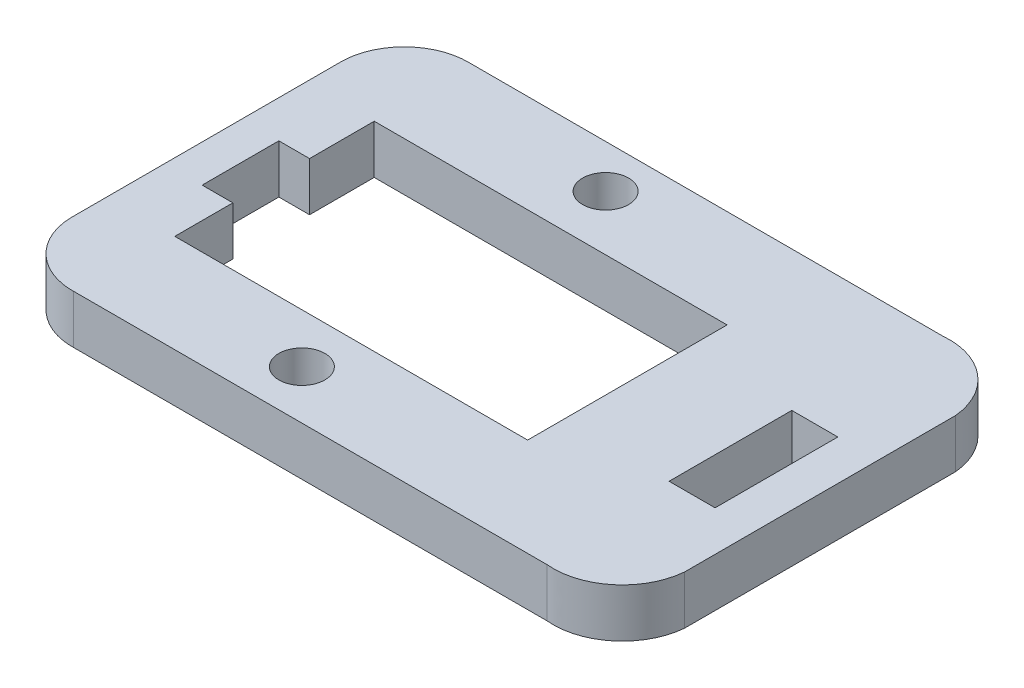
from build123d import *

# Parameters (mm, degrees)
SKETCH1_R           = 1.499950003
SKETCH1_R_2         = 1.49995001
SKETCH1_W           = 3.0001
SKETCH1_H           = 8
BOSS_EXTRUDE1_DEPTH = 3.175


with BuildPart() as part:
    # Sketch1 → Boss-Extrude1 (new body)
    with BuildSketch(Plane(origin=(0, 0, 0), x_dir=(1, 0, 0), z_dir=(0, 1, 0))):
        with BuildLine():
            Line((-15.7526, 12.89915), (15.1125, 12.89915))
            add(Edge.make_bspline(
                [(15.1125, 12.89915), (17.575103024, 13.12464748), (19.77450252, 11.294353024), (20, 8.83175)],
                knots=[0.111111111, 0.111111111, 0.111111111, 0.111111111, 0.222222222, 0.222222222, 0.222222222, 0.222222222], degree=3))
            Line((20, 8.83175), (20, -8.83175))
            add(Edge.make_bspline(
                [(20, -8.83175), (19.77450252, -11.294353024), (17.575103024, -13.12464748), (15.1125, -12.89915)],
                knots=[0.333333333, 0.333333333, 0.333333333, 0.333333333, 0.444444444, 0.444444444, 0.444444444, 0.444444444], degree=3))
            Line((15.1125, -12.89915), (-15.7526, -12.89915))
            add(Edge.make_bspline(
                [(-15.7526, -12.89915), (-18.039200664, -12.948650664), (-19.950499336, -11.118350664), (-20, -8.83175)],
                knots=[0.555555556, 0.555555556, 0.555555556, 0.555555556, 0.666666667, 0.666666667, 0.666666667, 0.666666667], degree=3))
            Line((-20, -8.83175), (-20, 8.83175))
            add(Edge.make_bspline(
                [(-20, 8.83175), (-19.950499336, 11.118350664), (-18.039200664, 12.948650664), (-15.7526, 12.89915)],
                knots=[0.777777778, 0.777777778, 0.777777778, 0.777777778, 1, 1, 1, 1], degree=3))
        make_face()
        with Locations((-4.06191002, 10.083599991)):
            Circle(SKETCH1_R, mode=Mode.SUBTRACT)
        with Locations((-4.06191002, -9.71635)):
            Circle(SKETCH1_R_2, mode=Mode.SUBTRACT)
        Polygon((-15.5612, 6.5), (7.4388, 6.5), (7.4388, -6.5), (-15.5612, -6.5), (-15.5612, -2.71635), (-17.5613, -2.71635), (-17.5613, 2.28365), (-15.5612, 2.28365), align=None, mode=Mode.SUBTRACT)
        with Locations((15.87435, -0.21635)):
            Rectangle(SKETCH1_W, SKETCH1_H, mode=Mode.SUBTRACT)
    extrude(amount=BOSS_EXTRUDE1_DEPTH)


solid = part.part
